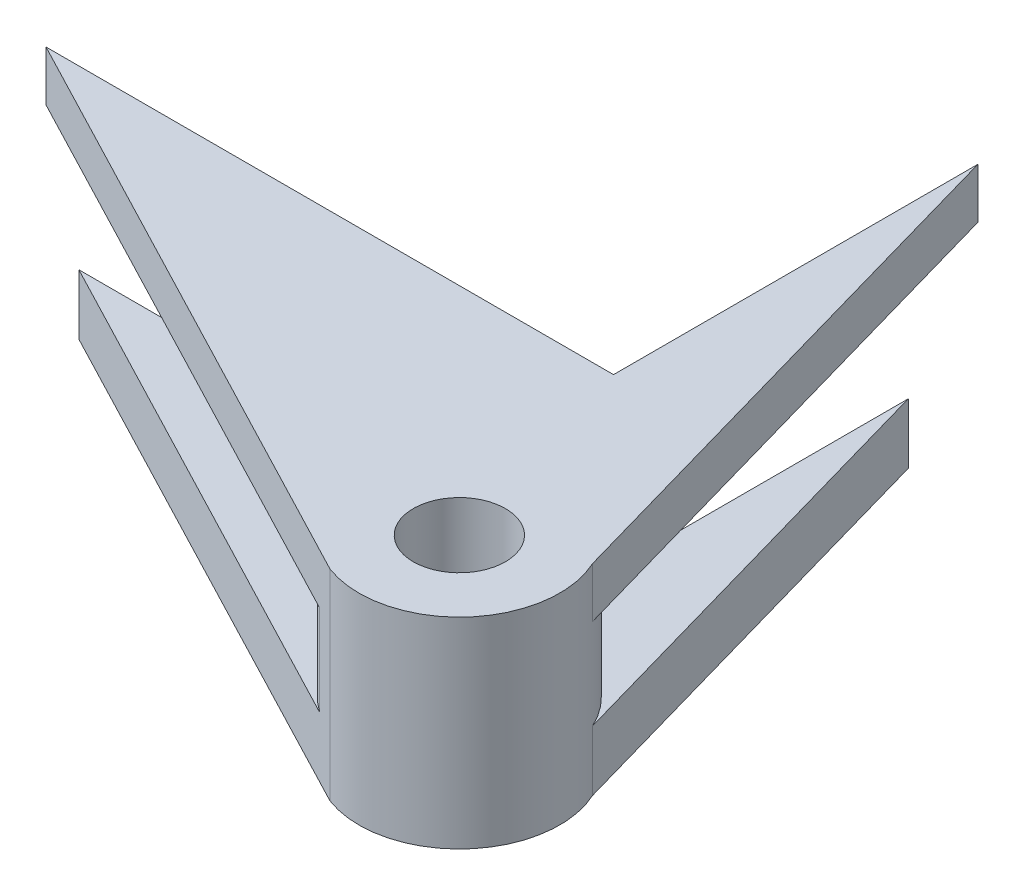
from build123d import *

# Parameters (mm, degrees)
BOSS_EXTRUDE1_DEPTH = 6
SKETCH1_3_R         = 4.590078396
BOSS_EXTRUDE2_DEPTH = 20
BOSS_EXTRUDE3_START = -5
BOSS_EXTRUDE3_DEPTH = 5


with BuildPart() as part:
    # Sketch1 → Boss-Extrude1 (new body)
    with BuildSketch(Plane(origin=(0, 0, 0), x_dir=(1, 0, 0), z_dir=(0, 1, 0))):
        with BuildLine():
            Line((43.089513356, -13.757633424), (30.598786144, 30.167258341))
            Line((30.598786144, 30.167258341), (30.598786144, 0))
            Line((30.598786144, 0), (0, 0))
            Line((0, 0), (-21.824717568, 0))
            Line((-21.824717568, 0), (28.34550387, -26.18781048))
            ThreePointArc((28.34550387, -26.18781048), (27.563302229, -10.300639589), (43.089513356, -13.757633424))
        make_face()
    extrude(amount=BOSS_EXTRUDE1_DEPTH)

    # Sketch1<3> → Boss-Extrude2 (add)
    with BuildSketch(Plane(origin=(0, 0, 0), x_dir=(1, 0, 0), z_dir=(0, 1, 0))):
        with BuildLine():
            ThreePointArc((44.008957527, -17.946130271), (43.776392152, -15.802017202), (43.089513356, -13.757633424))
            ThreePointArc((43.089513356, -13.757633424), (27.563302229, -10.300639589), (28.34550387, -26.18781048))
            Line((28.34550387, -26.18781048), (30.485399604, -27.304791477))
            ThreePointArc((30.485399604, -27.304791477), (39.699494443, -26.169133957), (44.008957527, -17.946130271))
        make_face()
        with Locations((34.008957527, -17.946130271)):
            Circle(SKETCH1_3_R, mode=Mode.SUBTRACT)
    extrude(amount=BOSS_EXTRUDE2_DEPTH)

    # Sketch2 → Boss-Extrude3 (add)
    with BuildSketch(Plane(origin=(0, 20, 0), x_dir=(1, 0, 0), z_dir=(0, 1, 0)).offset(BOSS_EXTRUDE3_START)):
        with BuildLine():
            ThreePointArc((28.34550387, -26.18781048), (27.563302229, -10.300639589), (43.089513356, -13.757633424))
            Line((43.089513356, -13.757633424), (30.598786144, 30.167258341))
            Line((30.598786144, 30.167258341), (27.839846696, 39.869344901))
            Line((27.839846696, 39.869344901), (27.839846696, 3.575781855))
            Line((27.839846696, 3.575781855), (-28.675147757, 3.575781855))
            Line((-28.675147757, 3.575781855), (-21.824717568, 0))
            Line((-21.824717568, 0), (28.34550387, -26.18781048))
        make_face()
    extrude(amount=BOSS_EXTRUDE3_DEPTH)


solid = part.part
